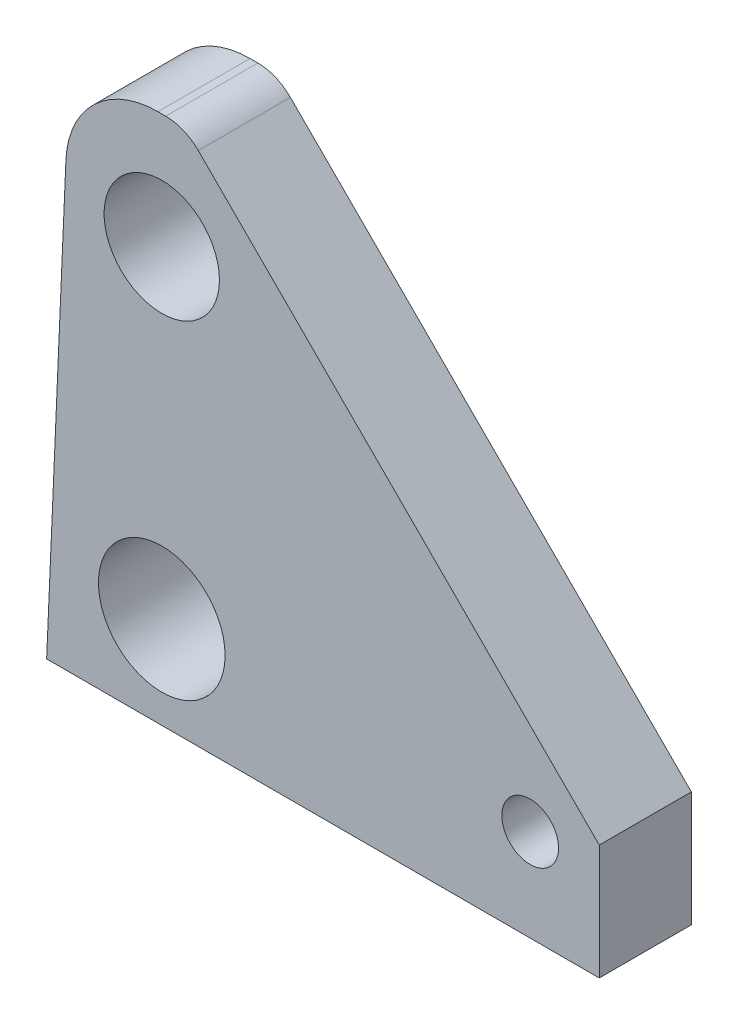
from build123d import *

# Parameters (mm, degrees)
SKETCH1_W          = 6.35
SKETCH1_H          = 36.5125
BASE_FLANGE1_DEPTH = 19.05
CUT_EXTRUDE1_REACH = 29.139
CUT_EXTRUDE2_REACH = 29.139
SKETCH4_R          = 4.365625
SKETCH4_R_2        = 1.9558
SKETCH4_R_3        = 3.9751
FILLET1_R          = 6.35
FILLET2_R          = 3.175


# Sheet-metal steps are written as plain solids
with BuildPart() as part:
    # Sketch1 → Base-Flange1 (new, symmetric)
    with BuildSketch(Plane(origin=(0, 0, 0), x_dir=(0, 0, -1), z_dir=(1, 0, 0))):
        with Locations((-3.175, 0)):
            Rectangle(SKETCH1_W, SKETCH1_H)
    extrude(amount=BASE_FLANGE1_DEPTH, both=True)

    # Sketch3 → Cut-Extrude1 (cut, up to next)
    with BuildSketch(Plane.XY.offset(6.35), mode=Mode.PRIVATE) as cut_extrude1_sk1:
        Polygon((-19.05, 18.25625), (-19.05, -18.25625), (-17.455829822, 18.25625), align=None)
    cut_extrude1_tool1 = extrude(cut_extrude1_sk1.sketch, amount=-CUT_EXTRUDE1_REACH, mode=Mode.PRIVATE) & part.part
    # Sketch3 → Cut-Extrude1 (cut, up to next)
    with BuildSketch(Plane.XY.offset(6.35), mode=Mode.PRIVATE) as cut_extrude1_sk2:
        Polygon((19.05, 18.25625), (19.05, -10.31875), (-9.525, 18.25625), align=None)
    cut_extrude1_tool2 = extrude(cut_extrude1_sk2.sketch, amount=-CUT_EXTRUDE1_REACH, mode=Mode.PRIVATE) & part.part
    add(cut_extrude1_tool1.solids().sort_by_distance((-18.51861, 6.085417, 6.35))[0], mode=Mode.SUBTRACT)
    add(cut_extrude1_tool2.solids().sort_by_distance((9.525, 8.73125, 6.35))[0], mode=Mode.SUBTRACT)

    # Sketch4 → Cut-Extrude2 (cut, up to next)
    with BuildSketch(Plane.XY.offset(6.35), mode=Mode.PRIVATE) as cut_extrude2_sk1:
        with Locations((-11.1125, -11.90625)):
            Circle(SKETCH4_R)
    cut_extrude2_tool1 = extrude(cut_extrude2_sk1.sketch, amount=-CUT_EXTRUDE2_REACH, mode=Mode.PRIVATE) & part.part
    # Sketch4 → Cut-Extrude2 (cut, up to next)
    with BuildSketch(Plane.XY.offset(6.35), mode=Mode.PRIVATE) as cut_extrude2_sk2:
        with Locations((14.2875, -11.90625)):
            Circle(SKETCH4_R_2)
    cut_extrude2_tool2 = extrude(cut_extrude2_sk2.sketch, amount=-CUT_EXTRUDE2_REACH, mode=Mode.PRIVATE) & part.part
    # Sketch4 → Cut-Extrude2 (cut, up to next)
    with BuildSketch(Plane.XY.offset(6.35), mode=Mode.PRIVATE) as cut_extrude2_sk3:
        with Locations((-11.1125, 10.31875)):
            Circle(SKETCH4_R_3)
    cut_extrude2_tool3 = extrude(cut_extrude2_sk3.sketch, amount=-CUT_EXTRUDE2_REACH, mode=Mode.PRIVATE) & part.part
    add(cut_extrude2_tool1.solids().sort_by_distance((-11.1125, -11.90625, 6.35))[0], mode=Mode.SUBTRACT)
    add(cut_extrude2_tool2.solids().sort_by_distance((14.2875, -11.90625, 6.35))[0], mode=Mode.SUBTRACT)
    add(cut_extrude2_tool3.solids().sort_by_distance((-11.1125, 10.31875, 6.35))[0], mode=Mode.SUBTRACT)

    # Fillet1
    fillet1_edges = [part.edges().sort_by_distance(p)[0] for p in [
        (-17.455829822, 18.25625, 3.175),
    ]]
    fillet(fillet1_edges, radius=FILLET1_R)

    # Fillet2
    fillet2_edges = [part.edges().sort_by_distance(p)[0] for p in [
        (-9.525, 18.25625, 3.175),
    ]]
    fillet(fillet2_edges, radius=FILLET2_R)


solid = part.part
